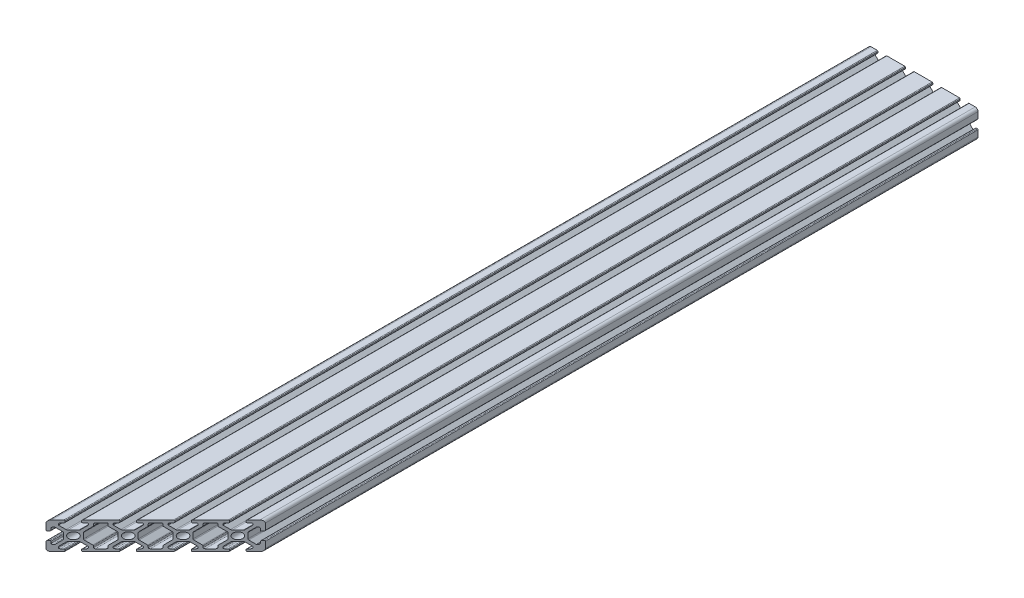
from build123d import *

# Parameters (mm, degrees)
SKETCH1_R           = 2.5
BOSS_EXTRUDE1_DEPTH = 300
CUT_EXTRUDE1_DEPTH  = 312.126983722


with BuildPart() as part:
    # Sketch1 → Boss-Extrude1 (new, symmetric)
    with BuildSketch(Plane.XY):
        with BuildLine():
            Line((2, 0), (6.5, 0))
            ThreePointArc((6.5, 0), (6.853553391, 0.146446609), (7, 0.5))
            Line((7, 0.5), (7, 1.3))
            ThreePointArc((7, 1.3), (6.853553391, 1.653553391), (6.5, 1.8))
            Line((6.5, 1.8), (5.25, 1.8))
            ThreePointArc((5.25, 1.8), (4.719669914, 2.019669914), (4.5, 2.55))
            Line((4.5, 2.55), (4.5, 3.227207794))
            Line((4.5, 3.227207794), (7.329898987, 6.057106781))
            ThreePointArc((7.329898987, 6.057106781), (7.654322336, 6.273879533), (8.037005769, 6.35))
            Line((8.037005769, 6.35), (11.962994231, 6.35))
            ThreePointArc((11.962994231, 6.35), (12.345677664, 6.273879533), (12.670101013, 6.057106781))
            Line((12.670101013, 6.057106781), (15.5, 3.227207794))
            Line((15.5, 3.227207794), (15.5, 2.55))
            ThreePointArc((15.5, 2.55), (15.280330086, 2.019669914), (14.75, 1.8))
            Line((14.75, 1.8), (13.5, 1.8))
            ThreePointArc((13.5, 1.8), (13.146446609, 1.653553391), (13, 1.3))
            Line((13, 1.3), (13, 0.5))
            ThreePointArc((13, 0.5), (13.146446609, 0.146446609), (13.5, 0))
            Line((13.5, 0), (26.5, 0))
            ThreePointArc((26.5, 0), (26.853553391, 0.146446609), (27, 0.5))
            Line((27, 0.5), (27, 1.3))
            ThreePointArc((27, 1.3), (26.853553391, 1.653553391), (26.5, 1.8))
            Line((26.5, 1.8), (25.25, 1.8))
            ThreePointArc((25.25, 1.8), (24.719669914, 2.019669914), (24.5, 2.55))
            Line((24.5, 2.55), (24.5, 3.227207794))
            Line((24.5, 3.227207794), (27.329898987, 6.057106781))
            ThreePointArc((27.329898987, 6.057106781), (27.654322336, 6.273879533), (28.037005769, 6.35))
            Line((28.037005769, 6.35), (31.962994231, 6.35))
            ThreePointArc((31.962994231, 6.35), (32.345677664, 6.273879533), (32.670101013, 6.057106781))
            Line((32.670101013, 6.057106781), (35.5, 3.227207794))
            Line((35.5, 3.227207794), (35.5, 2.55))
            ThreePointArc((35.5, 2.55), (35.280330086, 2.019669914), (34.75, 1.8))
            Line((34.75, 1.8), (33.5, 1.8))
            ThreePointArc((33.5, 1.8), (33.146446609, 1.653553391), (33, 1.3))
            Line((33, 1.3), (33, 0.5))
            ThreePointArc((33, 0.5), (33.146446609, 0.146446609), (33.5, 0))
            Line((33.5, 0), (46.5, 0))
            ThreePointArc((46.5, 0), (46.853553391, 0.146446609), (47, 0.5))
            Line((47, 0.5), (47, 1.3))
            ThreePointArc((47, 1.3), (46.853553391, 1.653553391), (46.5, 1.8))
            Line((46.5, 1.8), (45.25, 1.8))
            ThreePointArc((45.25, 1.8), (44.719669914, 2.019669914), (44.5, 2.55))
            Line((44.5, 2.55), (44.5, 3.227207794))
            Line((44.5, 3.227207794), (47.329898987, 6.057106781))
            ThreePointArc((47.329898987, 6.057106781), (47.654322336, 6.273879533), (48.037005769, 6.35))
            Line((48.037005769, 6.35), (51.962994231, 6.35))
            ThreePointArc((51.962994231, 6.35), (52.345677664, 6.273879533), (52.670101013, 6.057106781))
            Line((52.670101013, 6.057106781), (55.5, 3.227207794))
            Line((55.5, 3.227207794), (55.5, 2.55))
            ThreePointArc((55.5, 2.55), (55.280330086, 2.019669914), (54.75, 1.8))
            Line((54.75, 1.8), (53.5, 1.8))
            ThreePointArc((53.5, 1.8), (53.146446609, 1.653553391), (53, 1.3))
            Line((53, 1.3), (53, 0.5))
            ThreePointArc((53, 0.5), (53.146446609, 0.146446609), (53.5, 0))
            Line((53.5, 0), (66.5, 0))
            ThreePointArc((66.5, 0), (66.853553391, 0.146446609), (67, 0.5))
            Line((67, 0.5), (67, 1.3))
            ThreePointArc((67, 1.3), (66.853553391, 1.653553391), (66.5, 1.8))
            Line((66.5, 1.8), (65.25, 1.8))
            ThreePointArc((65.25, 1.8), (64.719669914, 2.019669914), (64.5, 2.55))
            Line((64.5, 2.55), (64.5, 3.227207794))
            Line((64.5, 3.227207794), (67.329898987, 6.057106781))
            ThreePointArc((67.329898987, 6.057106781), (67.654322336, 6.273879533), (68.037005769, 6.35))
            Line((68.037005769, 6.35), (71.962994231, 6.35))
            ThreePointArc((71.962994231, 6.35), (72.345677664, 6.273879533), (72.670101013, 6.057106781))
            Line((72.670101013, 6.057106781), (75.5, 3.227207794))
            Line((75.5, 3.227207794), (75.5, 2.55))
            ThreePointArc((75.5, 2.55), (75.280330086, 2.019669914), (74.75, 1.8))
            Line((74.75, 1.8), (73.5, 1.8))
            ThreePointArc((73.5, 1.8), (73.146446609, 1.653553391), (73, 1.3))
            Line((73, 1.3), (73, 0.5))
            ThreePointArc((73, 0.5), (73.146446609, 0.146446609), (73.5, 0))
            Line((73.5, 0), (78, 0))
            ThreePointArc((78, 0), (79.414213562, 0.585786438), (80, 2))
            Line((80, 2), (80, 6.5))
            ThreePointArc((80, 6.5), (79.853553391, 6.853553391), (79.5, 7))
            Line((79.5, 7), (78.7, 7))
            ThreePointArc((78.7, 7), (78.346446609, 6.853553391), (78.2, 6.5))
            Line((78.2, 6.5), (78.2, 5.25))
            ThreePointArc((78.2, 5.25), (77.980330086, 4.719669914), (77.45, 4.5))
            Line((77.45, 4.5), (76.772792206, 4.5))
            Line((76.772792206, 4.5), (73.942893219, 7.329898987))
            ThreePointArc((73.942893219, 7.329898987), (73.726120467, 7.654322336), (73.65, 8.037005769))
            Line((73.65, 8.037005769), (73.65, 11.962994231))
            ThreePointArc((73.65, 11.962994231), (73.726120467, 12.345677664), (73.942893219, 12.670101013))
            Line((73.942893219, 12.670101013), (76.772792206, 15.5))
            Line((76.772792206, 15.5), (77.45, 15.5))
            ThreePointArc((77.45, 15.5), (77.980330086, 15.280330086), (78.2, 14.75))
            Line((78.2, 14.75), (78.2, 13.5))
            ThreePointArc((78.2, 13.5), (78.346446609, 13.146446609), (78.7, 13))
            Line((78.7, 13), (79.5, 13))
            ThreePointArc((79.5, 13), (79.853553391, 13.146446609), (80, 13.5))
            Line((80, 13.5), (80, 18))
            ThreePointArc((80, 18), (79.414213562, 19.414213562), (78, 20))
            Line((78, 20), (73.5, 20))
            ThreePointArc((73.5, 20), (73.146446609, 19.853553391), (73, 19.5))
            Line((73, 19.5), (73, 18.7))
            ThreePointArc((73, 18.7), (73.146446609, 18.346446609), (73.5, 18.2))
            Line((73.5, 18.2), (74.75, 18.2))
            ThreePointArc((74.75, 18.2), (75.280330086, 17.980330086), (75.5, 17.45))
            Line((75.5, 17.45), (75.5, 16.772792206))
            Line((75.5, 16.772792206), (72.670101013, 13.942893219))
            ThreePointArc((72.670101013, 13.942893219), (72.345677664, 13.726120467), (71.962994231, 13.65))
            Line((71.962994231, 13.65), (68.037005769, 13.65))
            ThreePointArc((68.037005769, 13.65), (67.654322336, 13.726120467), (67.329898987, 13.942893219))
            Line((67.329898987, 13.942893219), (64.5, 16.772792206))
            Line((64.5, 16.772792206), (64.5, 17.45))
            ThreePointArc((64.5, 17.45), (64.719669914, 17.980330086), (65.25, 18.2))
            Line((65.25, 18.2), (66.5, 18.2))
            ThreePointArc((66.5, 18.2), (66.853553391, 18.346446609), (67, 18.7))
            Line((67, 18.7), (67, 19.5))
            ThreePointArc((67, 19.5), (66.853553391, 19.853553391), (66.5, 20))
            Line((66.5, 20), (53.5, 20))
            ThreePointArc((53.5, 20), (53.146446609, 19.853553391), (53, 19.5))
            Line((53, 19.5), (53, 18.7))
            ThreePointArc((53, 18.7), (53.146446609, 18.346446609), (53.5, 18.2))
            Line((53.5, 18.2), (54.75, 18.2))
            ThreePointArc((54.75, 18.2), (55.280330086, 17.980330086), (55.5, 17.45))
            Line((55.5, 17.45), (55.5, 16.772792206))
            Line((55.5, 16.772792206), (52.670101013, 13.942893219))
            ThreePointArc((52.670101013, 13.942893219), (52.345677664, 13.726120467), (51.962994231, 13.65))
            Line((51.962994231, 13.65), (48.037005769, 13.65))
            ThreePointArc((48.037005769, 13.65), (47.654322336, 13.726120467), (47.329898987, 13.942893219))
            Line((47.329898987, 13.942893219), (44.5, 16.772792206))
            Line((44.5, 16.772792206), (44.5, 17.45))
            ThreePointArc((44.5, 17.45), (44.719669914, 17.980330086), (45.25, 18.2))
            Line((45.25, 18.2), (46.5, 18.2))
            ThreePointArc((46.5, 18.2), (46.853553391, 18.346446609), (47, 18.7))
            Line((47, 18.7), (47, 19.5))
            ThreePointArc((47, 19.5), (46.853553391, 19.853553391), (46.5, 20))
            Line((46.5, 20), (33.5, 20))
            ThreePointArc((33.5, 20), (33.146446609, 19.853553391), (33, 19.5))
            Line((33, 19.5), (33, 18.7))
            ThreePointArc((33, 18.7), (33.146446609, 18.346446609), (33.5, 18.2))
            Line((33.5, 18.2), (34.75, 18.2))
            ThreePointArc((34.75, 18.2), (35.280330086, 17.980330086), (35.5, 17.45))
            Line((35.5, 17.45), (35.5, 16.772792206))
            Line((35.5, 16.772792206), (32.670101013, 13.942893219))
            ThreePointArc((32.670101013, 13.942893219), (32.345677664, 13.726120467), (31.962994231, 13.65))
            Line((31.962994231, 13.65), (28.037005769, 13.65))
            ThreePointArc((28.037005769, 13.65), (27.654322336, 13.726120467), (27.329898987, 13.942893219))
            Line((27.329898987, 13.942893219), (24.5, 16.772792206))
            Line((24.5, 16.772792206), (24.5, 17.45))
            ThreePointArc((24.5, 17.45), (24.719669914, 17.980330086), (25.25, 18.2))
            Line((25.25, 18.2), (26.5, 18.2))
            ThreePointArc((26.5, 18.2), (26.853553391, 18.346446609), (27, 18.7))
            Line((27, 18.7), (27, 19.5))
            ThreePointArc((27, 19.5), (26.853553391, 19.853553391), (26.5, 20))
            Line((26.5, 20), (13.5, 20))
            ThreePointArc((13.5, 20), (13.146446609, 19.853553391), (13, 19.5))
            Line((13, 19.5), (13, 18.7))
            ThreePointArc((13, 18.7), (13.146446609, 18.346446609), (13.5, 18.2))
            Line((13.5, 18.2), (14.75, 18.2))
            ThreePointArc((14.75, 18.2), (15.280330086, 17.980330086), (15.5, 17.45))
            Line((15.5, 17.45), (15.5, 16.772792206))
            Line((15.5, 16.772792206), (12.670101013, 13.942893219))
            ThreePointArc((12.670101013, 13.942893219), (12.345677664, 13.726120467), (11.962994231, 13.65))
            Line((11.962994231, 13.65), (8.037005769, 13.65))
            ThreePointArc((8.037005769, 13.65), (7.654322336, 13.726120467), (7.329898987, 13.942893219))
            Line((7.329898987, 13.942893219), (4.5, 16.772792206))
            Line((4.5, 16.772792206), (4.5, 17.45))
            ThreePointArc((4.5, 17.45), (4.719669914, 17.980330086), (5.25, 18.2))
            Line((5.25, 18.2), (6.5, 18.2))
            ThreePointArc((6.5, 18.2), (6.853553391, 18.346446609), (7, 18.7))
            Line((7, 18.7), (7, 19.5))
            ThreePointArc((7, 19.5), (6.853553391, 19.853553391), (6.5, 20))
            Line((6.5, 20), (2, 20))
            ThreePointArc((2, 20), (0.585786438, 19.414213562), (0, 18))
            Line((0, 18), (0, 13.5))
            ThreePointArc((0, 13.5), (0.146446609, 13.146446609), (0.5, 13))
            Line((0.5, 13), (1.3, 13))
            ThreePointArc((1.3, 13), (1.653553391, 13.146446609), (1.8, 13.5))
            Line((1.8, 13.5), (1.8, 14.75))
            ThreePointArc((1.8, 14.75), (2.019669914, 15.280330086), (2.55, 15.5))
            Line((2.55, 15.5), (3.227207794, 15.5))
            Line((3.227207794, 15.5), (6.057106781, 12.670101013))
            ThreePointArc((6.057106781, 12.670101013), (6.273879533, 12.345677664), (6.35, 11.962994231))
            Line((6.35, 11.962994231), (6.35, 8.037005769))
            ThreePointArc((6.35, 8.037005769), (6.273879533, 7.654322336), (6.057106781, 7.329898987))
            Line((6.057106781, 7.329898987), (3.227207794, 4.5))
            Line((3.227207794, 4.5), (2.55, 4.5))
            ThreePointArc((2.55, 4.5), (2.019669914, 4.719669914), (1.8, 5.25))
            Line((1.8, 5.25), (1.8, 6.5))
            ThreePointArc((1.8, 6.5), (1.653553391, 6.853553391), (1.3, 7))
            Line((1.3, 7), (0.5, 7))
            ThreePointArc((0.5, 7), (0.146446609, 6.853553391), (0, 6.5))
            Line((0, 6.5), (0, 2))
            ThreePointArc((0, 2), (0.585786438, 0.585786438), (2, 0))
        make_face()
        with Locations((10, 10)):
            Circle(SKETCH1_R, mode=Mode.SUBTRACT)
        with Locations((30, 10)):
            Circle(SKETCH1_R, mode=Mode.SUBTRACT)
        with Locations((50, 10)):
            Circle(SKETCH1_R, mode=Mode.SUBTRACT)
        with Locations((70, 10)):
            Circle(SKETCH1_R, mode=Mode.SUBTRACT)
        with BuildLine():
            Line((33.942893219, 12.670101013), (37.080330086, 15.80753788))
            ThreePointArc((37.080330086, 15.80753788), (37.242909649, 16.050855391), (37.3, 16.337867966))
            Line((37.3, 16.337867966), (37.3, 17.45))
            ThreePointArc((37.3, 17.45), (37.519669914, 17.980330086), (38.05, 18.2))
            Line((38.05, 18.2), (41.95, 18.2))
            ThreePointArc((41.95, 18.2), (42.480330086, 17.980330086), (42.7, 17.45))
            Line((42.7, 17.45), (42.7, 16.337867966))
            ThreePointArc((42.7, 16.337867966), (42.757090351, 16.050855391), (42.919669914, 15.80753788))
            Line((42.919669914, 15.80753788), (46.057106781, 12.670101013))
            ThreePointArc((46.057106781, 12.670101013), (46.273879533, 12.345677664), (46.35, 11.962994231))
            Line((46.35, 11.962994231), (46.35, 8.037005769))
            ThreePointArc((46.35, 8.037005769), (46.273879533, 7.654322336), (46.057106781, 7.329898987))
            Line((46.057106781, 7.329898987), (42.919669914, 4.19246212))
            ThreePointArc((42.919669914, 4.19246212), (42.757090351, 3.949144609), (42.7, 3.662132034))
            Line((42.7, 3.662132034), (42.7, 2.55))
            ThreePointArc((42.7, 2.55), (42.480330086, 2.019669914), (41.95, 1.8))
            Line((41.95, 1.8), (38.05, 1.8))
            ThreePointArc((38.05, 1.8), (37.519669914, 2.019669914), (37.3, 2.55))
            Line((37.3, 2.55), (37.3, 3.662132034))
            ThreePointArc((37.3, 3.662132034), (37.242909649, 3.949144609), (37.080330086, 4.19246212))
            Line((37.080330086, 4.19246212), (33.942893219, 7.329898987))
            ThreePointArc((33.942893219, 7.329898987), (33.726120467, 7.654322336), (33.65, 8.037005769))
            Line((33.65, 8.037005769), (33.65, 11.962994231))
            ThreePointArc((33.65, 11.962994231), (33.726120467, 12.345677664), (33.942893219, 12.670101013))
        make_face(mode=Mode.SUBTRACT)
        with BuildLine():
            Line((22.919669914, 15.80753788), (26.057106781, 12.670101013))
            ThreePointArc((26.057106781, 12.670101013), (26.273879533, 12.345677664), (26.35, 11.962994231))
            Line((26.35, 11.962994231), (26.35, 8.037005769))
            ThreePointArc((26.35, 8.037005769), (26.273879533, 7.654322336), (26.057106781, 7.329898987))
            Line((26.057106781, 7.329898987), (22.919669914, 4.19246212))
            ThreePointArc((22.919669914, 4.19246212), (22.757090351, 3.949144609), (22.7, 3.662132034))
            Line((22.7, 3.662132034), (22.7, 2.55))
            ThreePointArc((22.7, 2.55), (22.480330086, 2.019669914), (21.95, 1.8))
            Line((21.95, 1.8), (18.05, 1.8))
            ThreePointArc((18.05, 1.8), (17.519669914, 2.019669914), (17.3, 2.55))
            Line((17.3, 2.55), (17.3, 3.662132034))
            ThreePointArc((17.3, 3.662132034), (17.242909649, 3.949144609), (17.080330086, 4.19246212))
            Line((17.080330086, 4.19246212), (13.942893219, 7.329898987))
            ThreePointArc((13.942893219, 7.329898987), (13.726120467, 7.654322336), (13.65, 8.037005769))
            Line((13.65, 8.037005769), (13.65, 11.962994231))
            ThreePointArc((13.65, 11.962994231), (13.726120467, 12.345677664), (13.942893219, 12.670101013))
            Line((13.942893219, 12.670101013), (17.080330086, 15.80753788))
            ThreePointArc((17.080330086, 15.80753788), (17.242909649, 16.050855391), (17.3, 16.337867966))
            Line((17.3, 16.337867966), (17.3, 17.45))
            ThreePointArc((17.3, 17.45), (17.519669914, 17.980330086), (18.05, 18.2))
            Line((18.05, 18.2), (21.95, 18.2))
            ThreePointArc((21.95, 18.2), (22.480330086, 17.980330086), (22.7, 17.45))
            Line((22.7, 17.45), (22.7, 16.337867966))
            ThreePointArc((22.7, 16.337867966), (22.757090351, 16.050855391), (22.919669914, 15.80753788))
        make_face(mode=Mode.SUBTRACT)
        with BuildLine():
            Line((62.919669914, 15.80753788), (66.057106781, 12.670101013))
            ThreePointArc((66.057106781, 12.670101013), (66.273879533, 12.345677664), (66.35, 11.962994231))
            Line((66.35, 11.962994231), (66.35, 8.037005769))
            ThreePointArc((66.35, 8.037005769), (66.273879533, 7.654322336), (66.057106781, 7.329898987))
            Line((66.057106781, 7.329898987), (62.919669914, 4.19246212))
            ThreePointArc((62.919669914, 4.19246212), (62.757090351, 3.949144609), (62.7, 3.662132034))
            Line((62.7, 3.662132034), (62.7, 2.55))
            ThreePointArc((62.7, 2.55), (62.480330086, 2.019669914), (61.95, 1.8))
            Line((61.95, 1.8), (58.05, 1.8))
            ThreePointArc((58.05, 1.8), (57.519669914, 2.019669914), (57.3, 2.55))
            Line((57.3, 2.55), (57.3, 3.662132034))
            ThreePointArc((57.3, 3.662132034), (57.242909649, 3.949144609), (57.080330086, 4.19246212))
            Line((57.080330086, 4.19246212), (53.942893219, 7.329898987))
            ThreePointArc((53.942893219, 7.329898987), (53.726120467, 7.654322336), (53.65, 8.037005769))
            Line((53.65, 8.037005769), (53.65, 11.962994231))
            ThreePointArc((53.65, 11.962994231), (53.726120467, 12.345677664), (53.942893219, 12.670101013))
            Line((53.942893219, 12.670101013), (57.080330086, 15.80753788))
            ThreePointArc((57.080330086, 15.80753788), (57.242909649, 16.050855391), (57.3, 16.337867966))
            Line((57.3, 16.337867966), (57.3, 17.45))
            ThreePointArc((57.3, 17.45), (57.519669914, 17.980330086), (58.05, 18.2))
            Line((58.05, 18.2), (61.95, 18.2))
            ThreePointArc((61.95, 18.2), (62.480330086, 17.980330086), (62.7, 17.45))
            Line((62.7, 17.45), (62.7, 16.337867966))
            ThreePointArc((62.7, 16.337867966), (62.757090351, 16.050855391), (62.919669914, 15.80753788))
        make_face(mode=Mode.SUBTRACT)
    extrude(amount=BOSS_EXTRUDE1_DEPTH, both=True)

    # Sketch2 → Cut-Extrude1 (cut, through all)
    with BuildSketch(Plane(origin=(0, 20, 0), x_dir=(1, 0, 0), z_dir=(0, 1, 0))):
        Polygon((0, -300), (80, -220), (80, -300), align=None)
    extrude(amount=-CUT_EXTRUDE1_DEPTH, mode=Mode.SUBTRACT)


solid = part.part
